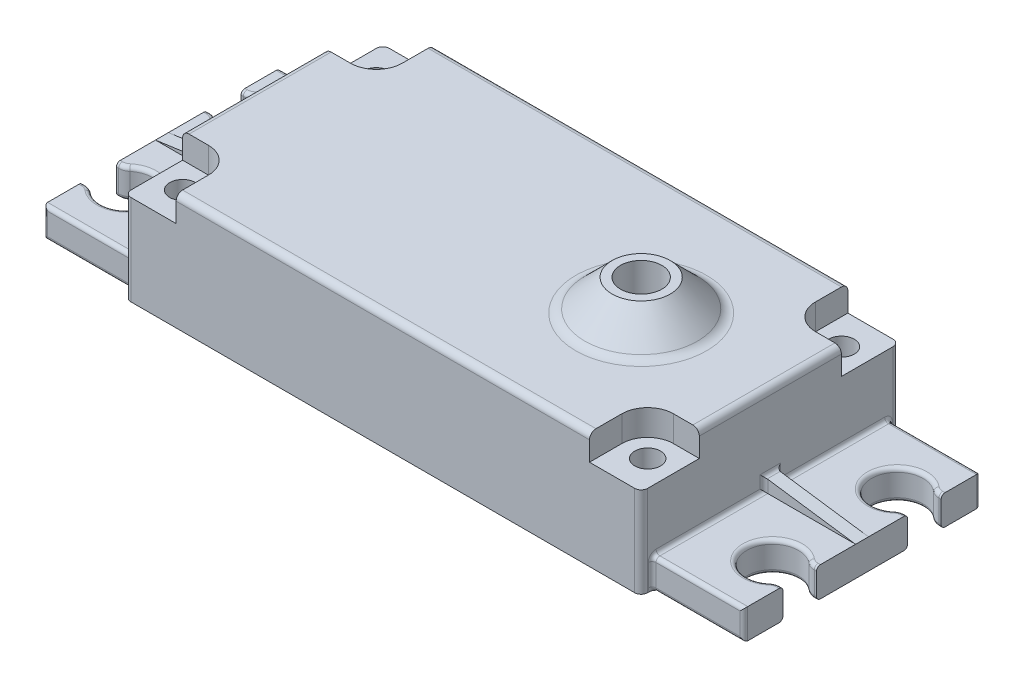
from build123d import *

# Parameters (mm, degrees)
SKETCH1_W           = 40
SKETCH1_H           = 20
SKETCH1_R           = 1
BOSS_EXTRUDE1_DEPTH = 7
BOSS_EXTRUDE2_DEPTH = 2
SKETCH3_R           = 2.25
BOSS_EXTRUDE3_DEPTH = 2.4
CHAMFER2_SIZE       = 2.4
CUT_EXTRUDE1_REACH  = 27.099
SKETCH5_R           = 1.6
FILLET1_R           = 0.5
FILLET2_R           = 0.5
FILLET3_R           = 1
FILLET4_R           = 0.5
CUT_EXTRUDE2_DEPTH  = 2.5
SKETCH7_W           = 18.3
SKETCH7_H           = 2.3
BOSS_EXTRUDE4_DEPTH = 7.1
CUT_EXTRUDE3_REACH  = 90.858
RIB8_REACH          = 33.054
SKETCH12_WALL_W     = 71.278691248
SKETCH12_WALL_H     = 1
FILLET5_R           = 0.3
FILLET12_R          = 0.3
FILLET13_START      = -28
FILLET13_DEPTH      = 8
FILLET13_START_2    = 20
FILLET13_2_DEPTH    = 8
FILLET14_R          = 0.3


with BuildPart() as part:
    # Sketch1 → Boss-Extrude1 (new body)
    with BuildSketch(Plane(origin=(0, 0, 0), x_dir=(1, 0, 0), z_dir=(0, 1, 0))):
        Rectangle(SKETCH1_W, SKETCH1_H)
        with Locations(Location((-18, 7.5, 0), (0, 0, 270))):
            Circle(SKETCH1_R, mode=Mode.SUBTRACT)
        with Locations(Location((18, 7.5, 0), (0, 0, 270))):
            Circle(SKETCH1_R, mode=Mode.SUBTRACT)
        with Locations(Location((18, -7.5, 0), (0, 0, 270))):
            Circle(SKETCH1_R, mode=Mode.SUBTRACT)
        with Locations(Location((-18, -7.5, 0), (0, 0, 270))):
            Circle(SKETCH1_R, mode=Mode.SUBTRACT)
        with BuildLine():
            Line((6, 8.3), (6, -8.3))
            Line((6, -8.3), (-7.230072203, -8.3))
            ThreePointArc((-7.230072203, -8.3), (-18.75, 0), (-7.230072203, 8.3))
            Line((-7.230072203, 8.3), (6, 8.3))
        make_face(mode=Mode.SUBTRACT)
    extrude(amount=BOSS_EXTRUDE1_DEPTH)

    # Sketch2 → Boss-Extrude2 (add)
    with BuildSketch(Plane(origin=(0, 7, 0), x_dir=(1, 0, 0), z_dir=(0, 1, 0))):
        with BuildLine():
            Line((-16, 7.5), (-16, 10))
            Line((-16, 10), (16, 10))
            Line((16, 10), (16, 7.5))
            ThreePointArc((16, 7.5), (16.585786438, 6.085786438), (18, 5.5))
            Line((18, 5.5), (20, 5.5))
            Line((20, 5.5), (20, -5.5))
            Line((20, -5.5), (18, -5.5))
            ThreePointArc((18, -5.5), (16.585786438, -6.085786438), (16, -7.5))
            Line((16, -7.5), (16, -10))
            Line((16, -10), (-16, -10))
            Line((-16, -10), (-16, -7.5))
            ThreePointArc((-16, -7.5), (-16.585786438, -6.085786438), (-18, -5.5))
            Line((-18, -5.5), (-20, -5.5))
            Line((-20, -5.5), (-20, 5.5))
            Line((-20, 5.5), (-18, 5.5))
            ThreePointArc((-18, 5.5), (-16.585786438, 6.085786438), (-16, 7.5))
        make_face()
    extrude(amount=BOSS_EXTRUDE2_DEPTH)

    # Sketch3 → Boss-Extrude3 (add)
    with BuildSketch(Plane(origin=(0, 9, 0), x_dir=(1, 0, 0), z_dir=(0, 1, 0))):
        with Locations(Location((10, 0, 0), (0, 0, 270))):
            Circle(SKETCH3_R)
    extrude(amount=BOSS_EXTRUDE3_DEPTH)

    # Chamfer2
    chamfer2_edges = [part.edges().sort_by_distance(p)[0] for p in [
        (10, 9, -2.25),
    ]]
    chamfer(chamfer2_edges, length=CHAMFER2_SIZE - 0.0001)  # a hair under: the kernel refuses the full size

    # Sketch5 → Cut-Extrude1 (cut, up to next)
    with BuildSketch(Plane(origin=(0, 11.4, 0), x_dir=(1, 0, 0), z_dir=(0, 1, 0)), mode=Mode.PRIVATE) as cut_extrude1_sk1:
        with Locations(Location((10, 0, 0), (0, 0, 270))):
            Circle(SKETCH5_R)
    cut_extrude1_tool1 = extrude(cut_extrude1_sk1.sketch, amount=-CUT_EXTRUDE1_REACH, mode=Mode.PRIVATE) & part.part
    add(cut_extrude1_tool1.solids().sort_by_distance((10, 11.4, 0))[0], mode=Mode.SUBTRACT)

    # Fillet1
    fillet1_edges = [part.edges().sort_by_distance(p)[0] for p in [
        (-20, 9, 0),
        (0, 9, 10),
        (20, 9, 0),
        (0, 9, -10),
    ]]
    fillet(fillet1_edges, radius=FILLET1_R)

    # Fillet2
    fillet2_edges = [part.edges().sort_by_distance(p)[0] for p in [
        (20, 3.5, 10),
        (-20, 3.5, 10),
        (-20, 3.5, -10),
        (20, 3.5, -10),
    ]]
    fillet(fillet2_edges, radius=FILLET2_R)

    # Fillet3
    fillet3_edges = [part.edges().sort_by_distance(p)[0] for p in [
        (10, 9, -4.6499),
    ]]
    fillet(fillet3_edges, radius=FILLET3_R)

    # Fillet4
    fillet4_edges = [part.edges().sort_by_distance(p)[0] for p in [
        (-0.615036102, 0, -8.3),
        (-18.75, 0, 0),
        (-0.615036102, 0, 8.3),
        (6, 0, 0),
    ]]
    fillet(fillet4_edges, radius=FILLET4_R)

    # Sketch6 → Cut-Extrude2 (cut)
    with BuildSketch(Plane.XZ):
        Polygon((13, 1.732050808), (10, 3.464101615), (7, 1.732050808), (7, -1.732050808), (10, -3.464101615), (13, -1.732050808), align=None)
    extrude(amount=-CUT_EXTRUDE2_DEPTH, mode=Mode.SUBTRACT)

    # Sketch7 → Boss-Extrude4 (add)
    with BuildSketch(Plane(origin=(20, 0, 0), x_dir=(0, 0, -1), z_dir=(1, 0, 0))):
        with Locations((0, 1.15)):
            Rectangle(SKETCH7_W, SKETCH7_H)
    boss_extrude4 = extrude(amount=BOSS_EXTRUDE4_DEPTH)

    # Sketch9 → Cut-Extrude3 (cut, up to next)
    with BuildSketch(Plane(origin=(67.689113973, 2.3, -1.119396885), x_dir=(-1, 0, 0), z_dir=(0, 1, 0)), mode=Mode.PRIVATE) as cut_extrude3_sk1:
        with BuildLine():
            Line((40.762977944, 7.244396885), (38.295712859, 7.244396885))
            Line((38.295712859, 7.244396885), (38.295712859, 4.644396885))
            Line((38.295712859, 4.644396885), (40.762977944, 4.644396885))
            ThreePointArc((40.762977944, 4.644396885), (41.10454297, 4.58425503), (41.405023287, 4.411063552))
            ThreePointArc((41.405023287, 4.411063552), (44.689113973, 5.944396885), (41.405023287, 7.477730218))
            ThreePointArc((41.405023287, 7.477730218), (41.10454297, 7.30453874), (40.762977944, 7.244396885))
        make_face()
    cut_extrude3_tool1 = extrude(cut_extrude3_sk1.sketch, amount=-CUT_EXTRUDE3_REACH, mode=Mode.PRIVATE) & part.part
    # Sketch9 → Cut-Extrude3 (cut, up to next)
    with BuildSketch(Plane(origin=(67.689113973, 2.3, -1.119396885), x_dir=(-1, 0, 0), z_dir=(0, 1, 0)), mode=Mode.PRIVATE) as cut_extrude3_sk2:
        with BuildLine():
            Line((38.295712859, -5.005603115), (38.295712859, -2.405603115))
            Line((38.295712859, -2.405603115), (40.762977944, -2.405603115))
            ThreePointArc((40.762977944, -2.405603115), (41.10454297, -2.34546126), (41.405023287, -2.172269782))
            ThreePointArc((41.405023287, -2.172269782), (44.689113973, -3.705603115), (41.405023287, -5.238936448))
            ThreePointArc((41.405023287, -5.238936448), (41.10454297, -5.06574497), (40.762977944, -5.005603115))
            Line((40.762977944, -5.005603115), (38.295712859, -5.005603115))
        make_face()
    cut_extrude3_tool2 = extrude(cut_extrude3_sk2.sketch, amount=-CUT_EXTRUDE3_REACH, mode=Mode.PRIVATE) & part.part
    cut_extrude3_1 = cut_extrude3_tool1.solids().sort_by_distance((26.076088, 2.3, 4.825))[0]
    add(cut_extrude3_1, mode=Mode.SUBTRACT)
    cut_extrude3_2 = cut_extrude3_tool2.solids().sort_by_distance((26.076088, 2.3, -4.825))[0]
    add(cut_extrude3_2, mode=Mode.SUBTRACT)
    cut_extrude3 = cut_extrude3_1 + cut_extrude3_2  # Cut-Extrude3 as one shape, for the pattern or mirror that repeats it

    # Sketch12 wall → Rib8 (add, up to next)
    with BuildSketch(Plane(origin=(23.55, 2.8, 0), x_dir=(-0.990226505106, 0.139468521846, 0), z_dir=(-0.139468521846, -0.990226505106, 0)), mode=Mode.PRIVATE) as rib8_sk1:
        Rectangle(SKETCH12_WALL_W, SKETCH12_WALL_H)
    rib8_tool1 = extrude(rib8_sk1.sketch, amount=RIB8_REACH, mode=Mode.PRIVATE) - part.part
    rib8 = rib8_tool1.solids().sort_by_distance((23.55, 2.8, 0))[0]
    add(rib8)

    # Mirror1: Boss-Extrude4, Cut-Extrude3, Rib8 across plane
    add(boss_extrude4.mirror(Plane(origin=(0, 0, 0), x_dir=(0, 0, 1), z_dir=(1, 0, 0))))
    add(cut_extrude3.mirror(Plane(origin=(0, 0, 0), x_dir=(0, 0, 1), z_dir=(1, 0, 0))), mode=Mode.SUBTRACT)
    add(rib8.mirror(Plane(origin=(0, 0, 0), x_dir=(0, 0, 1), z_dir=(1, 0, 0))))

    # Fillet5
    fillet5_edges = [part.edges().sort_by_distance(p)[0] for p in [
        (27.013068014, 2.3, 3.525),
        (26.584571003, 2.3, 3.464858145),
        (23, 2.3, 4.825),
        (26.584571003, 2.3, 6.185141855),
        (27.013068014, 2.3, 6.125),
        (26.584571003, 0, 6.185141855),
        (23, 0, 4.825),
        (26.584571003, 0, 3.464858145),
        (27.013068014, 0, 3.525),
        (27.013068014, 0, 6.125),
        (27.013068014, 2.3, -3.525),
        (27.013068014, 2.3, -6.125),
        (26.584571003, 2.3, -6.185141855),
        (23, 2.3, -4.825),
        (26.584571003, 2.3, -3.464858145),
        (23, 0, -4.825),
        (26.584571003, 0, -6.185141855),
        (27.013068014, 0, -6.125),
        (27.013068014, 0, -3.525),
        (26.584571003, 0, -3.464858145),
        (-26.584571003, 0, 6.185141855),
        (-27.013068014, 0, 6.125),
        (-27.013068014, 0, 3.525),
        (-26.584571003, 0, 3.464858145),
        (-23, 0, 4.825),
        (-26.584571003, 2.3, 6.185141855),
        (-27.013068014, 2.3, 6.125),
        (-27.013068014, 2.3, 3.525),
        (-26.584571003, 2.3, 3.464858145),
        (-23, 2.3, 4.825),
        (-23, 2.3, -4.825),
        (-26.584571003, 2.3, -3.464858145),
        (-27.013068014, 2.3, -3.525),
        (-27.013068014, 2.3, -6.125),
        (-26.584571003, 2.3, -6.185141855),
        (-26.584571003, 0, -3.464858145),
        (-27.013068014, 0, -3.525),
        (-27.013068014, 0, -6.125),
        (-26.584571003, 0, -6.185141855),
        (-23, 0, -4.825),
    ]]
    fillet(fillet5_edges, radius=FILLET5_R)

    # Fillet12
    fillet12_edges = [part.edges().sort_by_distance(p)[0] for p in [
        (27.1, 1.15, -9.15),
        (27.1, 1.15, 9.15),
        (-27.1, 1.15, -9.15),
        (-27.1, 1.15, 9.15),
    ]]
    fillet(fillet12_edges, radius=FILLET12_R)

    # Fillet13: read off the stored shape, not the designer's step
    # Fillet13 outline → Fillet13 (cut)
    with BuildSketch(Plane.YZ.offset(FILLET13_START)):
        with BuildLine():
            ThreePointArc((2.3, -8.85), (2.212132034, -9.062132034), (2, -9.15))
            Line((2, -9.15), (2.3, -9.15))
            Line((2.3, -9.15), (2.3, -8.85))
        make_face()
        with BuildLine():
            Line((2.3, 9.15), (2, 9.15))
            ThreePointArc((2, 9.15), (2.212132034, 9.062132034), (2.3, 8.85))
            Line((2.3, 8.85), (2.3, 9.15))
        make_face()
        with BuildLine():
            Line((0, 9.15), (0, 8.85))
            ThreePointArc((0, 8.85), (0.087867966, 9.062132034), (0.3, 9.15))
            Line((0.3, 9.15), (0, 9.15))
        make_face()
        with BuildLine():
            ThreePointArc((0.3, -9.15), (0.087867966, -9.062132034), (0, -8.85))
            Line((0, -8.85), (0, -9.15))
            Line((0, -9.15), (0.3, -9.15))
        make_face()
    extrude(amount=FILLET13_DEPTH, mode=Mode.SUBTRACT)

    # Fillet13 2 outline → Fillet13 2 (cut)
    with BuildSketch(Plane.YZ.offset(FILLET13_START_2)):
        with BuildLine():
            ThreePointArc((2.3, -8.85), (2.212132034, -9.062132034), (2, -9.15))
            Line((2, -9.15), (2.3, -9.15))
            Line((2.3, -9.15), (2.3, -8.85))
        make_face()
        with BuildLine():
            Line((2.3, 9.15), (2, 9.15))
            ThreePointArc((2, 9.15), (2.212132034, 9.062132034), (2.3, 8.85))
            Line((2.3, 8.85), (2.3, 9.15))
        make_face()
        with BuildLine():
            Line((0, 9.15), (0, 8.85))
            ThreePointArc((0, 8.85), (0.087867966, 9.062132034), (0.3, 9.15))
            Line((0.3, 9.15), (0, 9.15))
        make_face()
        with BuildLine():
            ThreePointArc((0.3, -9.15), (0.087867966, -9.062132034), (0, -8.85))
            Line((0, -8.85), (0, -9.15))
            Line((0, -9.15), (0.3, -9.15))
        make_face()
    extrude(amount=FILLET13_2_DEPTH, mode=Mode.SUBTRACT)

    # Fillet14
    # the kernel refuses this fillet: 0.3 mm, written as the material it adds along each edge
    with BuildSketch(Plane(origin=(20, 2.3, -0.25), x_dir=(1, 0, 0), z_dir=(0, 0, 1)), Plane(origin=(20, 2.3, -8.85), x_dir=(1, 0, 0), z_dir=(0, 0, 1))) as fillet14_piece_1:
        with BuildLine():
            CenterArc((FILLET14_R, FILLET14_R), FILLET14_R, 180, 90)
            Line((0, FILLET14_R), (0, 0))
            Line((0, 0), (FILLET14_R, 0))
        make_face()
    extrude(amount=9.1)
    with BuildSketch(Plane(origin=(20, 3.3, 0.5), x_dir=(0.9902265051058254, -0.13946852184597863, 0), z_dir=(0, 0, -1))) as fillet14_piece_2:
        with BuildLine():
            CenterArc((FILLET14_R * 0.869024888464, -FILLET14_R), FILLET14_R, 90, 81.982906926)
            Line((-FILLET14_R * 0.121201616641, -FILLET14_R * 0.860531478154), (0, 0))
            Line((0, 0), (FILLET14_R * 0.869024888464, 0))
        make_face()
    extrude(amount=1)
    with BuildSketch(Plane(origin=(20, 4.05, -0.5), x_dir=(1, 0, 0), z_dir=(0, -1, 0))) as fillet14_piece_3_section:
        with BuildLine():
            CenterArc((FILLET14_R, -FILLET14_R), FILLET14_R, 90, 90)
            Line((0, -FILLET14_R), (0, 0))
            Line((0, 0), (FILLET14_R, 0))
        make_face()
    fillet14_piece_3 = extrude(amount=2.5, mode=Mode.PRIVATE)
    fillet14_piece_3 = split(fillet14_piece_3, bisect_by=Plane(origin=(19.89642093, 3.314588601, -0.5), z_dir=(-0.13946852184597555, -0.9902265051058262, 0)), keep=Keep.TOP, mode=Mode.PRIVATE)
    add(fillet14_piece_3)
    with BuildSketch(Plane(origin=(20, 1.55, 0.5), x_dir=(1, 0, 0), z_dir=(0, 1, 0))) as fillet14_piece_4_section:
        with BuildLine():
            CenterArc((FILLET14_R, -FILLET14_R), FILLET14_R, 90, 90)
            Line((0, -FILLET14_R), (0, 0))
            Line((0, 0), (FILLET14_R, 0))
        make_face()
    fillet14_piece_4 = extrude(amount=2.5, mode=Mode.PRIVATE)
    fillet14_piece_4 = split(fillet14_piece_4, bisect_by=Plane(origin=(20.241684497, 3.26595993, 0.5), z_dir=(-0.13946852184597555, -0.9902265051058262, 0)), keep=Keep.TOP, mode=Mode.PRIVATE)
    add(fillet14_piece_4)
    with BuildSketch(Plane(origin=(-20, 2.3, -0.25), x_dir=(-1, 0, 0), z_dir=(0, 0, 1)), Plane(origin=(-20, 2.3, -8.85), x_dir=(-1, 0, 0), z_dir=(0, 0, 1))) as fillet14_piece_5:
        with BuildLine():
            CenterArc((FILLET14_R, -FILLET14_R), FILLET14_R, 90, 90)
            Line((0, -FILLET14_R), (0, 0))
            Line((0, 0), (FILLET14_R, 0))
        make_face()
    extrude(amount=9.1)
    with BuildSketch(Plane(origin=(-20, 3.3, 0.5), x_dir=(-0.9902265051058254, -0.13946852184597863, 0), z_dir=(0, 0, -1))) as fillet14_piece_6:
        with BuildLine():
            CenterArc((FILLET14_R * 0.869024888464, FILLET14_R), FILLET14_R, 188.017093074, 81.982906926)
            Line((-FILLET14_R * 0.121201616641, FILLET14_R * 0.860531478154), (0, 0))
            Line((0, 0), (FILLET14_R * 0.869024888464, 0))
        make_face()
    extrude(amount=1)
    with BuildSketch(Plane(origin=(-20, 1.55, 0.5), x_dir=(-1, 0, 0), z_dir=(0, 1, 0))) as fillet14_piece_7_section:
        with BuildLine():
            CenterArc((FILLET14_R, FILLET14_R), FILLET14_R, 180, 90)
            Line((0, FILLET14_R), (0, 0))
            Line((0, 0), (FILLET14_R, 0))
        make_face()
    fillet14_piece_7 = extrude(amount=2.5, mode=Mode.PRIVATE)
    fillet14_piece_7 = split(fillet14_piece_7, bisect_by=Plane(origin=(-20.241684497, 3.26595993, 0.5), z_dir=(0.1394685218459756, -0.9902265051058262, 0)), keep=Keep.TOP, mode=Mode.PRIVATE)
    add(fillet14_piece_7)
    with BuildSketch(Plane(origin=(-20, 4.05, -0.5), x_dir=(-1, 0, 0), z_dir=(0, -1, 0))) as fillet14_piece_8_section:
        with BuildLine():
            CenterArc((FILLET14_R, FILLET14_R), FILLET14_R, 180, 90)
            Line((0, FILLET14_R), (0, 0))
            Line((0, 0), (FILLET14_R, 0))
        make_face()
    fillet14_piece_8 = extrude(amount=2.5, mode=Mode.PRIVATE)
    fillet14_piece_8 = split(fillet14_piece_8, bisect_by=Plane(origin=(-19.89642093, 3.314588601, -0.5), z_dir=(0.1394685218459756, -0.9902265051058262, 0)), keep=Keep.TOP, mode=Mode.PRIVATE)
    add(fillet14_piece_8)
    with BuildSketch(Plane(origin=(20, 0.3, -9.15), x_dir=(1, 0, 0), z_dir=(0, 1, 0)), Plane(origin=(20, 2, 9.15), x_dir=(1, 0, 0), z_dir=(0, -1, 0))) as fillet14_piece_9:
        with BuildLine():
            CenterArc((FILLET14_R, FILLET14_R), FILLET14_R, 180, 90)
            Line((0, FILLET14_R), (0, 0))
            Line((0, 0), (FILLET14_R, 0))
        make_face()
    extrude(amount=1.7)
    with BuildSketch(Plane(origin=(-20, 0.3, -9.15), x_dir=(-1, 0, 0), z_dir=(0, 1, 0)), Plane(origin=(-20, 2, 9.15), x_dir=(-1, 0, 0), z_dir=(0, -1, 0))) as fillet14_piece_10:
        with BuildLine():
            CenterArc((FILLET14_R, -FILLET14_R), FILLET14_R, 90, 90)
            Line((0, -FILLET14_R), (0, 0))
            Line((0, 0), (FILLET14_R, 0))
        make_face()
    extrude(amount=1.7)
    with BuildSketch(Plane(origin=(20, 0.300000001, -8.849999999), x_dir=(0, -4.051132746171946e-09, -1.0), z_dir=(0, 1.0, -4.051132746171946e-09))) as fillet14_piece_11_section:
        with BuildLine():
            CenterArc((0.300000001 + FILLET14_R, -FILLET14_R), FILLET14_R, 90, 90)
            Line((0.300000001 + FILLET14_R, 0), (0.300000001, 0))
            Line((0.300000001, 0), (0.300000001, -FILLET14_R))
        make_face()
    fillet14_piece_11 = revolve(axis=Axis((20, 0.300000001, -8.849999999), (-1, 0, 0)), revolution_arc=233.296988192, mode=Mode.PRIVATE)
    fillet14_piece_11 = split(fillet14_piece_11, bisect_by=Plane(origin=(20, 0, -8.849999999), z_dir=(0, 1, 0)), keep=Keep.TOP, mode=Mode.PRIVATE)
    add(fillet14_piece_11)
    with BuildSketch(Plane(origin=(20, 1.999999999, -8.849999999), x_dir=(0, 1.0, -4.051129785577225e-09), z_dir=(0, 4.051129785577225e-09, 1.0))) as fillet14_piece_12:
        with BuildLine():
            CenterArc((0.300000001 + FILLET14_R, -FILLET14_R), FILLET14_R, 90, 90)
            Line((0.300000001 + FILLET14_R, 0), (0.300000001, 0))
            Line((0.300000001, 0), (0.300000001, -FILLET14_R))
        make_face()
    revolve(axis=Axis((20, 1.999999999, -8.849999999), (-1, 0, 0)), revolution_arc=89.999999536)
    with BuildSketch(Plane(origin=(20, 0.300000001, 8.849999999), x_dir=(0, 0.8017442308147256, -0.5976672890122934), z_dir=(0, 0.5976672890122934, 0.8017442308147256))) as fillet14_piece_13_section:
        with BuildLine():
            CenterArc((0.300000001 + FILLET14_R, -FILLET14_R), FILLET14_R, 90, 90)
            Line((0.300000001 + FILLET14_R, 0), (0.300000001, 0))
            Line((0.300000001, 0), (0.300000001, -FILLET14_R))
        make_face()
    fillet14_piece_13 = revolve(axis=Axis((20, 0.300000001, 8.849999999), (-1, 0, 0)), revolution_arc=233.296988192, mode=Mode.PRIVATE)
    fillet14_piece_13 = split(fillet14_piece_13, bisect_by=Plane(origin=(20, 0, 8.849999999), z_dir=(0, 1, 0)), keep=Keep.TOP, mode=Mode.PRIVATE)
    add(fillet14_piece_13)
    with BuildSketch(Plane(origin=(20, 1.999999999, 8.849999999), x_dir=(0, 4.051132746171946e-09, 1.0), z_dir=(0, -1.0, 4.051132746171946e-09))) as fillet14_piece_14:
        with BuildLine():
            CenterArc((0.300000001 + FILLET14_R, -FILLET14_R), FILLET14_R, 90, 90)
            Line((0.300000001 + FILLET14_R, 0), (0.300000001, 0))
            Line((0.300000001, 0), (0.300000001, -FILLET14_R))
        make_face()
    revolve(axis=Axis((20, 1.999999999, 8.849999999), (-1, 0, 0)), revolution_arc=89.999999536)
    with BuildSketch(Plane(origin=(-20, 0.300000001, -8.849999999), x_dir=(0, -4.051132746171946e-09, -1.0), z_dir=(0, 1.0, -4.051132746171946e-09))) as fillet14_piece_15_section:
        with BuildLine():
            CenterArc((0.300000001 + FILLET14_R, FILLET14_R), FILLET14_R, 180, 90)
            Line((0.300000001 + FILLET14_R, 0), (0.300000001, 0))
            Line((0.300000001, 0), (0.300000001, FILLET14_R))
        make_face()
    fillet14_piece_15 = revolve(axis=Axis((-20, 0.300000001, -8.849999999), (-1, 0, 0)), revolution_arc=233.296988192, mode=Mode.PRIVATE)
    fillet14_piece_15 = split(fillet14_piece_15, bisect_by=Plane(origin=(-20, 0, -8.849999999), z_dir=(0, 1, 0)), keep=Keep.TOP, mode=Mode.PRIVATE)
    add(fillet14_piece_15)
    with BuildSketch(Plane(origin=(-20, 1.999999999, -8.849999999), x_dir=(0, 1.0, -4.051129785577225e-09), z_dir=(0, 4.051129785577225e-09, 1.0))) as fillet14_piece_16:
        with BuildLine():
            CenterArc((0.300000001 + FILLET14_R, FILLET14_R), FILLET14_R, 180, 90)
            Line((0.300000001 + FILLET14_R, 0), (0.300000001, 0))
            Line((0.300000001, 0), (0.300000001, FILLET14_R))
        make_face()
    revolve(axis=Axis((-20, 1.999999999, -8.849999999), (-1, 0, 0)), revolution_arc=89.999999536)
    with BuildSketch(Plane(origin=(-20, 0.300000001, 8.849999999), x_dir=(0, 0.8017442308147295, -0.5976672890122878), z_dir=(0, 0.5976672890122878, 0.8017442308147295))) as fillet14_piece_17_section:
        with BuildLine():
            CenterArc((0.300000001 + FILLET14_R, FILLET14_R), FILLET14_R, 180, 90)
            Line((0.300000001, FILLET14_R), (0.300000001, 0))
            Line((0.300000001, 0), (0.300000001 + FILLET14_R, 0))
        make_face()
    fillet14_piece_17 = revolve(axis=Axis((-20, 0.300000001, 8.849999999), (-1, 0, 0)), revolution_arc=233.296988192, mode=Mode.PRIVATE)
    fillet14_piece_17 = split(fillet14_piece_17, bisect_by=Plane(origin=(-20, 0, 8.849999999), z_dir=(0, 1, 0)), keep=Keep.TOP, mode=Mode.PRIVATE)
    add(fillet14_piece_17)
    with BuildSketch(Plane(origin=(-20, 1.999999999, 8.849999999), x_dir=(0, 4.051132746171946e-09, 1.0), z_dir=(0, -1.0, 4.051132746171946e-09))) as fillet14_piece_18:
        with BuildLine():
            CenterArc((0.300000001 + FILLET14_R, FILLET14_R), FILLET14_R, 180, 90)
            Line((0.300000001 + FILLET14_R, 0), (0.300000001, 0))
            Line((0.300000001, 0), (0.300000001, FILLET14_R))
        make_face()
    revolve(axis=Axis((-20, 1.999999999, 8.849999999), (-1, 0, 0)), revolution_arc=89.999999536)
    with BuildSketch(Plane(origin=(20, 3.3, 1.151768666), x_dir=(0.9902265051058254, -0.13946852184597863, 0), z_dir=(0, 0, -1))) as fillet14_piece_19a_section:
        with BuildLine():
            CenterArc((FILLET14_R * 0.869024888464, -FILLET14_R), FILLET14_R, 90, 81.982906926)
            Line((-FILLET14_R * 0.121201616641, -FILLET14_R * 0.860531478154), (0, 0))
            Line((0, 0), (FILLET14_R * 0.869024888464, 0))
        make_face()
    fillet14_piece_19a = extrude(amount=1.651768666, mode=Mode.PRIVATE)
    fillet14_piece_19a = split(fillet14_piece_19a, bisect_by=Plane(origin=(20, 3.3, 0.5), z_dir=(0, 0, 1)), keep=Keep.TOP, mode=Mode.PRIVATE)
    with BuildSketch(Plane(origin=(20, 2.3, 0.5), x_dir=(1, 0, 0), z_dir=(0, 1, 0))) as fillet14_piece_19b_section:
        with BuildLine():
            CenterArc((FILLET14_R, -FILLET14_R), FILLET14_R, 90, 90)
            Line((0, -FILLET14_R), (0, 0))
            Line((0, 0), (FILLET14_R, 0))
        make_face()
    fillet14_piece_19b = extrude(amount=1.75, mode=Mode.PRIVATE)
    fillet14_piece_19b = split(fillet14_piece_19b, bisect_by=Plane(origin=(20.138105427, 3.280548531, 0.5), z_dir=(0.13946852184597555, 0.9902265051058262, 0)), keep=Keep.TOP, mode=Mode.PRIVATE)
    fillet14_piece_19 = fillet14_piece_19a & fillet14_piece_19b
    add(fillet14_piece_19)
    with BuildSketch(Plane(origin=(20, 4.05, -0.5), x_dir=(1, 0, 0), z_dir=(0, -1, 0))) as fillet14_piece_20a_section:
        with BuildLine():
            CenterArc((FILLET14_R, -FILLET14_R), FILLET14_R, 90, 90)
            Line((0, -FILLET14_R), (0, 0))
            Line((0, 0), (FILLET14_R, 0))
        make_face()
    fillet14_piece_20a = extrude(amount=1.75, mode=Mode.PRIVATE)
    fillet14_piece_20a = split(fillet14_piece_20a, bisect_by=Plane(origin=(19.89642093, 3.314588601, -0.5), z_dir=(0.13946852184597555, 0.9902265051058262, 0)), keep=Keep.TOP, mode=Mode.PRIVATE)
    with BuildSketch(Plane(origin=(20, 3.3, 0.5), x_dir=(0.9902265051058254, -0.13946852184597863, 0), z_dir=(0, 0, -1))) as fillet14_piece_20b_section:
        with BuildLine():
            CenterArc((FILLET14_R * 0.869024888464, -FILLET14_R), FILLET14_R, 90, 81.982906926)
            Line((-FILLET14_R * 0.121201616641, -FILLET14_R * 0.860531478154), (0, 0))
            Line((0, 0), (FILLET14_R * 0.869024888464, 0))
        make_face()
    fillet14_piece_20b = extrude(amount=1.651768666, mode=Mode.PRIVATE)
    fillet14_piece_20b = split(fillet14_piece_20b, bisect_by=Plane(origin=(20, 3.3, -0.5), z_dir=(0, 0, -1)), keep=Keep.TOP, mode=Mode.PRIVATE)
    fillet14_piece_20 = fillet14_piece_20a & fillet14_piece_20b
    add(fillet14_piece_20)
    with BuildSketch(Plane(origin=(-20, 2.3, 0.5), x_dir=(-1, 0, 0), z_dir=(0, 1, 0))) as fillet14_piece_21a_section:
        with BuildLine():
            CenterArc((FILLET14_R, FILLET14_R), FILLET14_R, 180, 90)
            Line((0, FILLET14_R), (0, 0))
            Line((0, 0), (FILLET14_R, 0))
        make_face()
    fillet14_piece_21a = extrude(amount=1.75, mode=Mode.PRIVATE)
    fillet14_piece_21a = split(fillet14_piece_21a, bisect_by=Plane(origin=(-20.138105427, 3.280548531, 0.5), z_dir=(-0.1394685218459756, 0.9902265051058262, 0)), keep=Keep.TOP, mode=Mode.PRIVATE)
    with BuildSketch(Plane(origin=(-20, 3.3, 1.151768666), x_dir=(-0.9902265051058254, -0.13946852184597863, 0), z_dir=(0, 0, -1))) as fillet14_piece_21b_section:
        with BuildLine():
            CenterArc((FILLET14_R * 0.869024888464, FILLET14_R), FILLET14_R, 188.017093074, 81.982906926)
            Line((-FILLET14_R * 0.121201616641, FILLET14_R * 0.860531478154), (0, 0))
            Line((0, 0), (FILLET14_R * 0.869024888464, 0))
        make_face()
    fillet14_piece_21b = extrude(amount=1.651768666, mode=Mode.PRIVATE)
    fillet14_piece_21b = split(fillet14_piece_21b, bisect_by=Plane(origin=(-20, 3.3, 0.5), z_dir=(0, 0, 1)), keep=Keep.TOP, mode=Mode.PRIVATE)
    fillet14_piece_21 = fillet14_piece_21a & fillet14_piece_21b
    add(fillet14_piece_21)
    with BuildSketch(Plane(origin=(-20, 3.3, 0.5), x_dir=(-0.9902265051058254, -0.13946852184597863, 0), z_dir=(0, 0, -1))) as fillet14_piece_22a_section:
        with BuildLine():
            CenterArc((FILLET14_R * 0.869024888464, FILLET14_R), FILLET14_R, 188.017093074, 81.982906926)
            Line((-FILLET14_R * 0.121201616641, FILLET14_R * 0.860531478154), (0, 0))
            Line((0, 0), (FILLET14_R * 0.869024888464, 0))
        make_face()
    fillet14_piece_22a = extrude(amount=1.651768666, mode=Mode.PRIVATE)
    fillet14_piece_22a = split(fillet14_piece_22a, bisect_by=Plane(origin=(-20, 3.3, -0.5), z_dir=(0, 0, -1)), keep=Keep.TOP, mode=Mode.PRIVATE)
    with BuildSketch(Plane(origin=(-20, 4.05, -0.5), x_dir=(-1, 0, 0), z_dir=(0, -1, 0))) as fillet14_piece_22b_section:
        with BuildLine():
            CenterArc((FILLET14_R, FILLET14_R), FILLET14_R, 180, 90)
            Line((0, FILLET14_R), (0, 0))
            Line((0, 0), (FILLET14_R, 0))
        make_face()
    fillet14_piece_22b = extrude(amount=1.75, mode=Mode.PRIVATE)
    fillet14_piece_22b = split(fillet14_piece_22b, bisect_by=Plane(origin=(-19.89642093, 3.314588601, -0.5), z_dir=(-0.1394685218459756, 0.9902265051058262, 0)), keep=Keep.TOP, mode=Mode.PRIVATE)
    fillet14_piece_22 = fillet14_piece_22a & fillet14_piece_22b
    add(fillet14_piece_22)


solid = part.part
